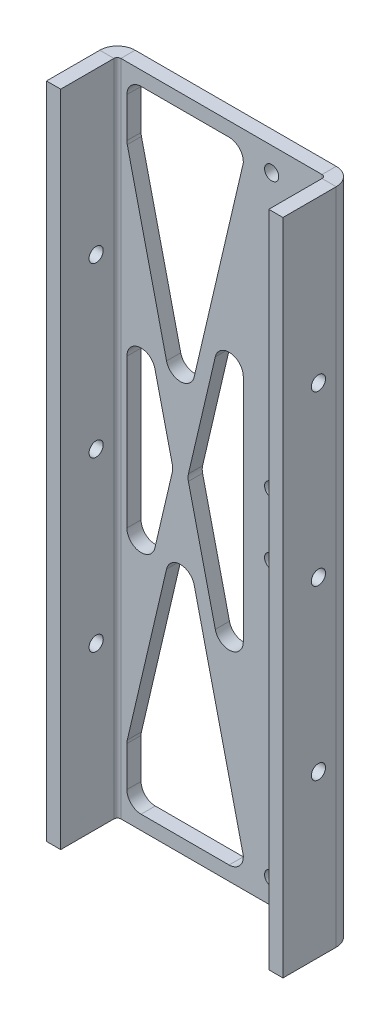
from build123d import *

# Parameters (mm, degrees)
SKETCH1_R                  = 1.5
BASE_FLANGE2_DEPTH         = 3
CUT_EXTRUDE1_DEPTH         = 3
FILLET2_R                  = 3
SKETCHED_START             = -72.08
SKETCHED_BEND2_OUTLINE_W   = 139.27076518
SKETCHED_BEND2_OUTLINE_H   = 3
SKETCHED_BEND2_DEPTH       = 11.04
SKETCHED_START_2           = -11.04
SKETCHED_BEND2_2_OUTLINE_W = 139.27076518
SKETCHED_BEND2_2_OUTLINE_H = 3
SKETCHED_BEND2_2_DEPTH     = 11.04
SKETCHED_START_3           = -60.687339692
SKETCHED_BEND2_3_OUTLINE_W = 139.27076518
SKETCHED_BEND2_3_OUTLINE_H = 11.999956935
SKETCHED_BEND2_3_OUTLINE_R = 1.5
SKETCHED_BEND2_3_DEPTH     = 2.647339692
SKETCHED_START_4           = -14.04
SKETCHED_BEND2_4_OUTLINE_W = 139.27076518
SKETCHED_BEND2_4_OUTLINE_H = 11.999956935
SKETCHED_BEND2_4_OUTLINE_R = 1.5
SKETCHED_BEND2_4_DEPTH     = 2.616101716
SKETCHED_START_5           = -14.7766
SKETCHED_BEND2_5_OUTLINE_W = 139.27076518
SKETCHED_BEND2_5_OUTLINE_H = 11.999956935
SKETCHED_BEND2_5_OUTLINE_R = 1.5
SKETCHED_BEND2_5_DEPTH     = 3.7366
SKETCHED_START_6           = -61.04
SKETCHED_BEND2_6_OUTLINE_W = 139.27076518
SKETCHED_BEND2_6_OUTLINE_H = 11.999956935
SKETCHED_BEND2_6_OUTLINE_R = 1.5
SKETCHED_BEND2_6_DEPTH     = 3.7366
SKETCHED_START_7           = -140
SKETCHED_BEND2_7_DEPTH     = 141


with BuildPart() as part:
    # Base-Flange2: sheet metal written as solids
    # Sketch1 → Base-Flange2 (new body)
    with BuildSketch(Plane.XY):
        Polygon((-72.08, -139.27076518), (-28.43, -139.27076518), (-22.43, -139.27076518), (0, -139.27076518), (0, 0), (-22.43, 0), (-28.43, 0), (-72.08, 0), align=None)
        with Locations((-25.43, -134.27076518)):
            Circle(SKETCH1_R, mode=Mode.SUBTRACT)
        with Locations((-25.43, -76.20135678)):
            Circle(SKETCH1_R, mode=Mode.SUBTRACT)
        with Locations((-25.43, -63.0694084)):
            Circle(SKETCH1_R, mode=Mode.SUBTRACT)
        with Locations((-25.43, -5)):
            Circle(SKETCH1_R, mode=Mode.SUBTRACT)
        with Locations((-64.58, -69.63538259)):
            Circle(SKETCH1_R, mode=Mode.SUBTRACT)
        with Locations((-64.58, -105.23606098)):
            Circle(SKETCH1_R, mode=Mode.SUBTRACT)
        with Locations((-64.58, -34.0347042)):
            Circle(SKETCH1_R, mode=Mode.SUBTRACT)
        with Locations(Location((-7.5, -105.23606098, 0), (0, 0, 180))):
            Circle(SKETCH1_R, mode=Mode.SUBTRACT)
        with Locations(Location((-7.5, -69.63538259, 0), (0, 0, 180))):
            Circle(SKETCH1_R, mode=Mode.SUBTRACT)
        with Locations(Location((-7.5, -34.0347042, 0), (0, 0, 180))):
            Circle(SKETCH1_R, mode=Mode.SUBTRACT)
    extrude(amount=-BASE_FLANGE2_DEPTH)

    # Sketch16 → Cut-Extrude1 (cut)
    with BuildSketch(Plane.XY):
        Polygon((-56.04, -3), (-56.04, -14.774529578), (-44.735, -63.055915667), (-31.43, -6.232930978), (-31.43, -3), align=None)
        Polygon((-31.43, -19.391864824), (-43.194429615, -69.63538259), (-31.43, -119.878900356), align=None)
        Polygon((-46.275570385, -69.63538259), (-56.04, -27.933463424), (-56.04, -111.337301756), align=None)
        Polygon((-44.735, -76.214849513), (-56.04, -124.496235602), (-56.04, -136.27076518), (-31.43, -136.27076518), (-31.43, -133.037834202), align=None)
    extrude(amount=-CUT_EXTRUDE1_DEPTH, mode=Mode.SUBTRACT)

    # Fillet2
    fillet2_edges = [part.edges().sort_by_distance(p)[0] for p in [
        (-31.43, -136.27076518, -1.5),
        (-44.735, -76.214849513, -1.5),
        (-56.04, -124.496235602, -1.5),
        (-56.04, -136.27076518, -1.5),
        (-56.04, -3, -1.5),
        (-56.04, -14.774529578, -1.5),
        (-44.735, -63.055915667, -1.5),
        (-31.43, -3, -1.5),
        (-31.43, -19.391864824, -1.5),
        (-43.194429615, -69.63538259, -1.5),
        (-31.43, -119.878900356, -1.5),
        (-56.04, -111.337301756, -1.5),
        (-46.275570385, -69.63538259, -1.5),
        (-56.04, -27.933463424, -1.5),
    ]]
    fillet(fillet2_edges, radius=FILLET2_R)

    # Sketched Bend2: read off the stored shape, not the designer's step
    # Sketched Bend2 outline → Sketched Bend2 (cut)
    with BuildSketch(Plane.YZ.offset(SKETCHED_START)):
        with Locations((-69.63538259, -1.5)):
            Rectangle(SKETCHED_BEND2_OUTLINE_W, SKETCHED_BEND2_OUTLINE_H)
    extrude(amount=SKETCHED_BEND2_DEPTH, mode=Mode.SUBTRACT)

    # Sketched Bend2 2 outline → Sketched Bend2 2 (cut)
    with BuildSketch(Plane.YZ.offset(SKETCHED_START_2)):
        with Locations((-69.63538259, -1.5)):
            Rectangle(SKETCHED_BEND2_2_OUTLINE_W, SKETCHED_BEND2_2_OUTLINE_H)
    extrude(amount=SKETCHED_BEND2_2_DEPTH, mode=Mode.SUBTRACT)

    # Sketched Bend2 3 outline → Sketched Bend2 3 (add)
    with BuildSketch(Plane.YZ.offset(SKETCHED_START_3)):
        with Locations((-69.63538259, 5.999978468)):
            Rectangle(SKETCHED_BEND2_3_OUTLINE_W, SKETCHED_BEND2_3_OUTLINE_H)
        with Locations((-105.23606098, 4.499956935)):
            Circle(SKETCHED_BEND2_3_OUTLINE_R, mode=Mode.SUBTRACT)
        with Locations((-69.63538259, 4.499956935)):
            Circle(SKETCHED_BEND2_3_OUTLINE_R, mode=Mode.SUBTRACT)
        with Locations((-34.0347042, 4.499956935)):
            Circle(SKETCHED_BEND2_3_OUTLINE_R, mode=Mode.SUBTRACT)
    extrude(amount=SKETCHED_BEND2_3_DEPTH)

    # Sketched Bend2 4 outline → Sketched Bend2 4 (add)
    with BuildSketch(Plane.YZ.offset(SKETCHED_START_4)):
        with Locations((-69.63538259, 5.999978468)):
            Rectangle(SKETCHED_BEND2_4_OUTLINE_W, SKETCHED_BEND2_4_OUTLINE_H)
        with Locations((-105.23606098, 4.499956935)):
            Circle(SKETCHED_BEND2_4_OUTLINE_R, mode=Mode.SUBTRACT)
        with Locations((-69.63538259, 4.499956935)):
            Circle(SKETCHED_BEND2_4_OUTLINE_R, mode=Mode.SUBTRACT)
        with Locations((-34.0347042, 4.499956935)):
            Circle(SKETCHED_BEND2_4_OUTLINE_R, mode=Mode.SUBTRACT)
    extrude(amount=SKETCHED_BEND2_4_DEPTH)

    # Sketched Bend2 5 outline → Sketched Bend2 5 (add)
    with BuildSketch(Plane.YZ.offset(SKETCHED_START_5)):
        with Locations((-69.63538259, 5.999978468)):
            Rectangle(SKETCHED_BEND2_5_OUTLINE_W, SKETCHED_BEND2_5_OUTLINE_H)
        with Locations((-105.23606098, 4.499956935)):
            Circle(SKETCHED_BEND2_5_OUTLINE_R, mode=Mode.SUBTRACT)
        with Locations((-69.63538259, 4.499956935)):
            Circle(SKETCHED_BEND2_5_OUTLINE_R, mode=Mode.SUBTRACT)
        with Locations((-34.0347042, 4.499956935)):
            Circle(SKETCHED_BEND2_5_OUTLINE_R, mode=Mode.SUBTRACT)
    extrude(amount=SKETCHED_BEND2_5_DEPTH)

    # Sketched Bend2 6 outline → Sketched Bend2 6 (add)
    with BuildSketch(Plane.YZ.offset(SKETCHED_START_6)):
        with Locations((-69.63538259, 5.999978468)):
            Rectangle(SKETCHED_BEND2_6_OUTLINE_W, SKETCHED_BEND2_6_OUTLINE_H)
        with Locations((-105.23606098, 4.499956935)):
            Circle(SKETCHED_BEND2_6_OUTLINE_R, mode=Mode.SUBTRACT)
        with Locations((-69.63538259, 4.499956935)):
            Circle(SKETCHED_BEND2_6_OUTLINE_R, mode=Mode.SUBTRACT)
        with Locations((-34.0347042, 4.499956935)):
            Circle(SKETCHED_BEND2_6_OUTLINE_R, mode=Mode.SUBTRACT)
    extrude(amount=SKETCHED_BEND2_6_DEPTH)

    # Sketched Bend2 7 outline → Sketched Bend2 7 (cut)
    with BuildSketch(Plane(origin=(0, 0, 0), x_dir=(1, 0, 0), z_dir=(0, 1, 0)).offset(SKETCHED_START_7)):
        with BuildLine():
            Line((-58.04, -0.7366), (-58.04, -11.999956935))
            Line((-58.04, -11.999956935), (-57.3034, -11.999956935))
            Line((-57.3034, -11.999956935), (-57.3034, 0))
            ThreePointArc((-57.3034, 0), (-57.824254855, -0.215745145), (-58.04, -0.7366))
        make_face()
        with BuildLine():
            Line((-14.7766, -11.999956935), (-14.04, -11.999956935))
            Line((-14.04, -11.999956935), (-14.04, -0.7366))
            ThreePointArc((-14.04, -0.7366), (-14.255745145, -0.215745145), (-14.7766, 0))
            Line((-14.7766, 0), (-14.7766, -11.999956935))
        make_face()
        with BuildLine():
            Line((-11.04, 3), (-14.7766, 3))
            ThreePointArc((-14.7766, 3), (-12.134424801, 1.905575199), (-11.04, -0.7366))
            Line((-11.04, -0.7366), (-11.04, 3))
        make_face()
        with BuildLine():
            ThreePointArc((-61.04, -0.7366), (-59.945575199, 1.905575199), (-57.3034, 3))
            Line((-57.3034, 3), (-61.04, 3))
            Line((-61.04, 3), (-61.04, -0.7366))
        make_face()
    extrude(amount=SKETCHED_BEND2_7_DEPTH, mode=Mode.SUBTRACT)


solid = part.part
